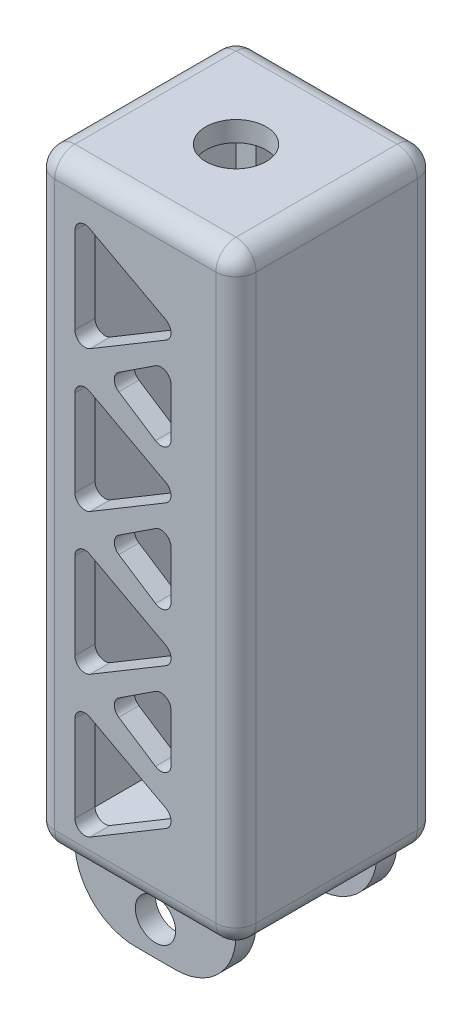
from build123d import *

# Parameters (mm, degrees)
SKETCH1_W           = 10
SKETCH1_H           = 30
BOSS_EXTRUDE1_DEPTH = 10
FILLET2_R           = 1
SKETCH2_W           = 8
SKETCH2_H           = 8
CUT_EXTRUDE1_DEPTH  = 28
SKETCH4_R           = 1.5
CUT_EXTRUDE2_DEPTH  = 8
CUT_EXTRUDE3_DEPTH  = 19.708286934
LPATTERN1_COUNT     = 4
LPATTERN1_PITCH     = 7
CUT_EXTRUDE4_DEPTH  = 19.708286934
LPATTERN2_COUNT     = 3
LPATTERN2_PITCH     = 7
SKETCH7_W           = 8
SKETCH7_H           = 1
BOSS_EXTRUDE2_DEPTH = 3
FILLET4_R           = 3
LPATTERN3_COUNT     = 2
LPATTERN3_PITCH     = 7
FILLET5_R           = 3
SKETCH8_R           = 1
CUT_EXTRUDE5_DEPTH  = 21.736441353


with BuildPart() as part:
    # Sketch1 → Boss-Extrude1 (new body)
    with BuildSketch(Plane.XY):
        Rectangle(SKETCH1_W, SKETCH1_H)
    extrude(amount=BOSS_EXTRUDE1_DEPTH)

    # Fillet2
    fillet2_edges = [part.edges().sort_by_distance(p)[0] for p in [
        (5, 0, 10),
        (0, 15, 10),
        (-5, 0, 10),
        (0, 15, 0),
        (5, 0, 0),
        (0, -15, 0),
        (-5, 0, 0),
        (-5, 15, 5),
        (5, 15, 5),
        (5, -15, 5),
        (-5, -15, 5),
        (0, -15, 10),
    ]]
    fillet(fillet2_edges, radius=FILLET2_R)

    # Sketch2 → Cut-Extrude1 (cut)
    with BuildSketch(Plane(origin=(0, 14, 0), x_dir=(1, 0, 0), z_dir=(0, 1, 0))):
        with Locations((0, -5)):
            Rectangle(SKETCH2_W, SKETCH2_H)
    extrude(amount=-CUT_EXTRUDE1_DEPTH, mode=Mode.SUBTRACT)

    # Sketch4 → Cut-Extrude2 (cut)
    with BuildSketch(Plane(origin=(0, 15, 0), x_dir=(1, 0, 0), z_dir=(0, 1, 0))):
        with Locations(Location((0, -5, 0), (0, 0, 270))):
            Circle(SKETCH4_R)
    extrude(amount=-CUT_EXTRUDE2_DEPTH, mode=Mode.SUBTRACT)

    # Sketch5 → Cut-Extrude3 (cut, through all)
    with BuildSketch(Plane.XY.offset(10)):
        with BuildLine():
            Line((-2.263626959, 12.736789234), (1.510119058, 10.712247379))
            ThreePointArc((1.510119058, 10.712247379), (1.773609184, 10.283344823), (1.530469097, 9.842587126))
            Line((1.530469097, 9.842587126), (-2.24327692, 7.584614681))
            ThreePointArc((-2.24327692, 7.584614681), (-2.746615551, 7.578726428), (-3, 8.013675586))
            Line((-3, 8.013675586), (-3, 12.296189886))
            ThreePointArc((-3, 12.296189886), (-2.75672308, 12.725250791), (-2.263626959, 12.736789234))
        make_face()
    cut_extrude3 = extrude(amount=-CUT_EXTRUDE3_DEPTH, mode=Mode.SUBTRACT)

    # LPattern1: Cut-Extrude3 ×4
    with Locations(*[(0, -i * LPATTERN1_PITCH, 0) for i in range(1, LPATTERN1_COUNT)]):
        add(cut_extrude3, mode=Mode.SUBTRACT)

    # Sketch6 → Cut-Extrude4 (cut, through all)
    with BuildSketch(Plane(origin=(0, 0, 0), x_dir=(-1, 0, 0), z_dir=(0, 0, -1))):
        with BuildLine():
            Line((-1.773746018, 8.053772264), (-1.773746018, 5.671291651))
            ThreePointArc((-1.773746018, 5.671291651), (-1.5114064, 5.231385363), (-0.999675848, 5.253098463))
            Line((-0.999675848, 5.253098463), (0.817992167, 6.44433877))
            ThreePointArc((0.817992167, 6.44433877), (1.043921997, 6.862531957), (0.817992167, 7.280725145))
            Line((0.817992167, 7.280725145), (-0.999675848, 8.471965452))
            ThreePointArc((-0.999675848, 8.471965452), (-1.5114064, 8.493678552), (-1.773746018, 8.053772264))
        make_face()
    cut_extrude4 = extrude(amount=-CUT_EXTRUDE4_DEPTH, mode=Mode.SUBTRACT)

    # LPattern2: Cut-Extrude4 ×3
    with Locations(*[(0, -i * LPATTERN2_PITCH, 0) for i in range(1, LPATTERN2_COUNT)]):
        add(cut_extrude4, mode=Mode.SUBTRACT)

    # Sketch7 → Boss-Extrude2 (add)
    with BuildSketch(Plane.XZ.offset(15)):
        with Locations((0, 8.5)):
            Rectangle(SKETCH7_W, SKETCH7_H)
    boss_extrude2 = extrude(amount=BOSS_EXTRUDE2_DEPTH)

    # Fillet4
    fillet4_edges = [part.edges().sort_by_distance(p)[0] for p in [
        (4, -18, 8.5),
        (-4, -18, 8.5),
    ]]
    fillet(fillet4_edges, radius=FILLET4_R - 0.0001)  # a hair under: the kernel refuses the full size

    # LPattern3: Boss-Extrude2 ×2
    with Locations(*[(0, 0, -i * LPATTERN3_PITCH) for i in range(1, LPATTERN3_COUNT)]):
        add(boss_extrude2)

    # Fillet5
    fillet5_edges = [part.edges().sort_by_distance(p)[0] for p in [
        (4, -18, 1.5),
        (-4, -18, 1.5),
    ]]
    fillet(fillet5_edges, radius=FILLET5_R - 0.0001)  # a hair under: the kernel refuses the full size

    # Sketch8 → Cut-Extrude5 (cut, through all)
    with BuildSketch(Plane.XY.offset(9)):
        with Locations((0, -16.338268511)):
            Circle(SKETCH8_R)
    extrude(amount=-CUT_EXTRUDE5_DEPTH, mode=Mode.SUBTRACT)


solid = part.part
